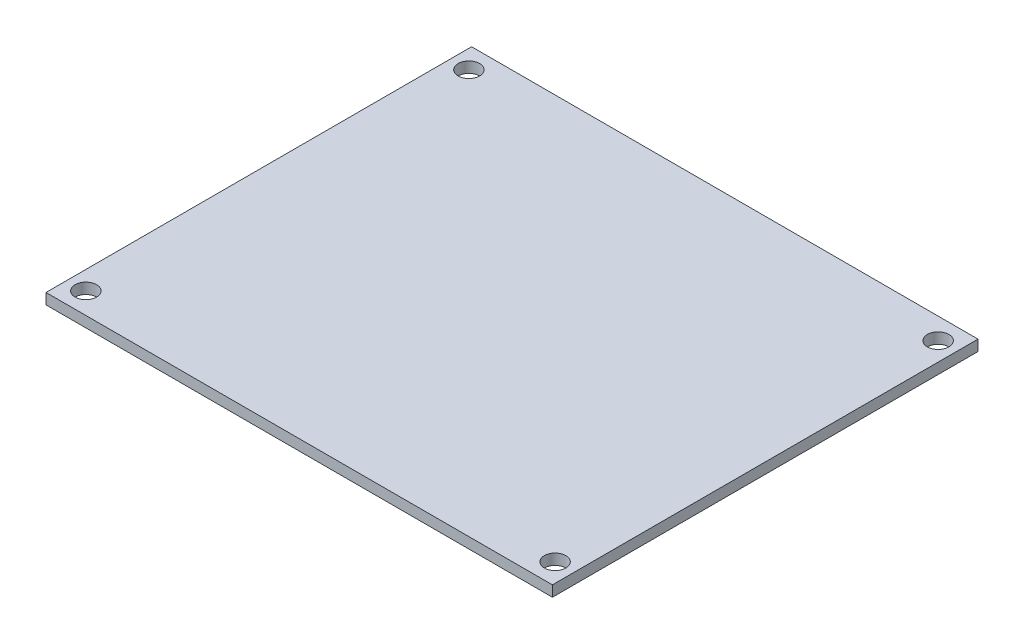
from build123d import *

# Parameters (mm, degrees)
SKETCH1_W                     = 94
SKETCH1_H                     = 79
BASE_FLANGE1_DEPTH            = 2
F_4_0MM_START                 = -2
F_4_0MM_DOWEL_HOLE1_OUTLINE_R = 2
F_4_0MM_DOWEL_HOLE1_DEPTH     = 2


# Read off the part's stored shape, not the designer's step: Ø4.0mm Dowel Hole1
# Sheet-metal steps are written as plain solids
with BuildPart() as part:
    # Sketch1 → Base-Flange1 (new body)
    with BuildSketch(Plane(origin=(0, 0, 0), x_dir=(1, 0, 0), z_dir=(0, 1, 0))):
        Rectangle(SKETCH1_W, SKETCH1_H)
    extrude(amount=-BASE_FLANGE1_DEPTH)

    # Ø4.0mm Dowel Hole1 outline → Ø4.0mm Dowel Hole1 (cut)
    with BuildSketch(Plane(origin=(0, 0, 0), x_dir=(1, 0, 0), z_dir=(0, 1, 0)).offset(F_4_0MM_START)):
        with Locations((43.55, 35.55)):
            Circle(F_4_0MM_DOWEL_HOLE1_OUTLINE_R)
        with Locations((-43.55, -35.55)):
            Circle(F_4_0MM_DOWEL_HOLE1_OUTLINE_R)
        with Locations((-43.55, 35.55)):
            Circle(F_4_0MM_DOWEL_HOLE1_OUTLINE_R)
        with Locations((43.55, -35.55)):
            Circle(F_4_0MM_DOWEL_HOLE1_OUTLINE_R)
    extrude(amount=F_4_0MM_DOWEL_HOLE1_DEPTH, mode=Mode.SUBTRACT)


solid = part.part
